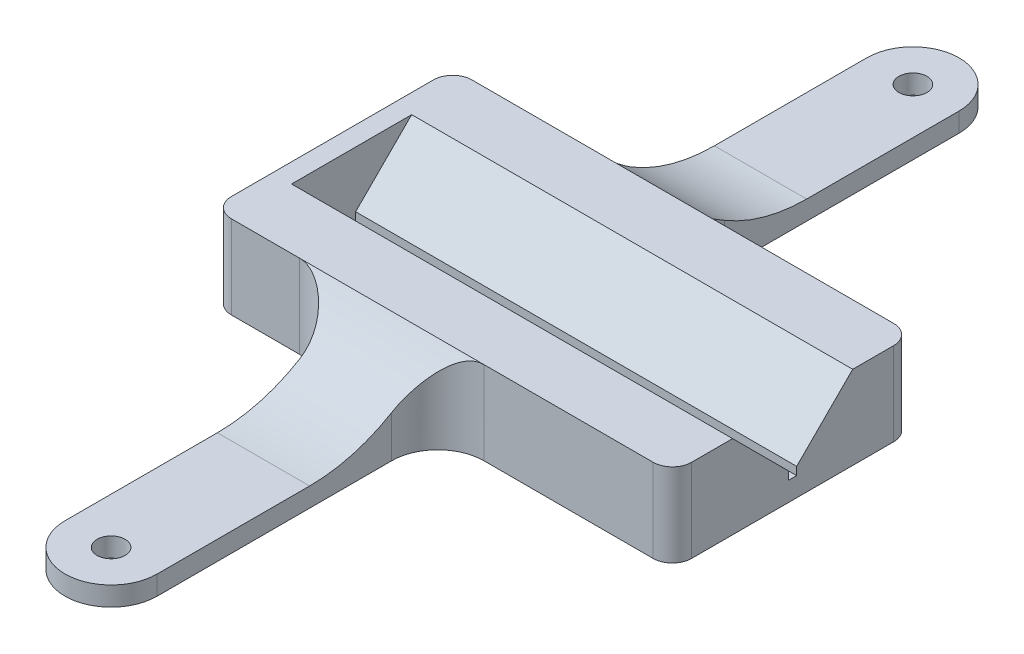
from build123d import *

# Parameters (mm, degrees)
SKETCH1_R           = 1.75
BOSS_EXTRUDE1_DEPTH = 2.4
BOSS_EXTRUDE2_DEPTH = 57.4
SKETCH3_W           = 30
SKETCH3_H           = 10.390128061
BOSS_EXTRUDE3_DEPTH = 2.4
FILLET1_START       = -61.5000001
FILLET1_DEPTH       = 23.0000001
FILLET1_START_2     = 2.4
FILLET1_2_DEPTH     = 7.99015084
FILLET2_R           = 2.4


with BuildPart() as part:
    # Sketch1 → Boss-Extrude1 (new body)
    with BuildSketch(Plane(origin=(0, 0, 0), x_dir=(1, 0, 0), z_dir=(0, 1, 0))):
        with BuildLine():
            Line((-44.25, 50), (-44.25, 20.75))
            ThreePointArc((-44.25, 20.75), (-42.565863992, 16.684136008), (-38.5, 15))
            Line((-38.5, 15), (-15, 15))
            Line((-15, 15), (-15, -15))
            Line((-15, -15), (-38.5, -15))
            ThreePointArc((-38.5, -15), (-42.565863992, -16.684136008), (-44.25, -20.75))
            Line((-44.25, -20.75), (-44.25, -50))
            ThreePointArc((-44.25, -50), (-50, -55.75), (-55.75, -50))
            Line((-55.75, -50), (-55.75, -20.75))
            ThreePointArc((-55.75, -20.75), (-57.434136008, -16.684136008), (-61.5, -15))
            Line((-61.5, -15), (-72.4, -15))
            Line((-72.4, -15), (-72.4, 15))
            Line((-72.4, 15), (-61.5, 15))
            ThreePointArc((-61.5, 15), (-57.434136008, 16.684136008), (-55.75, 20.75))
            Line((-55.75, 20.75), (-55.75, 50))
            ThreePointArc((-55.75, 50), (-50, 55.75), (-44.25, 50))
        make_face()
        with Locations(Location((-50, 50, 0), (0, 0, 270))):
            Circle(SKETCH1_R, mode=Mode.SUBTRACT)
        with Locations(Location((-50, -50, 0), (0, 0, 270))):
            Circle(SKETCH1_R, mode=Mode.SUBTRACT)
    extrude(amount=BOSS_EXTRUDE1_DEPTH)

    # Sketch2 → Boss-Extrude2 (add)
    with BuildSketch(Plane(origin=(-15, 0, 0), x_dir=(0, 0, -1), z_dir=(1, 0, 0))):
        Polygon((-15, 0), (-15, 10.390128061), (-7.490128061, 10.390128061), (-0.5, 3.4), (-0.5, 2.4), (0.5, 2.4), (0.5, 3.4), (7.490128061, 10.390128061), (15, 10.390128061), (15, 0), align=None)
    extrude(amount=-BOSS_EXTRUDE2_DEPTH)

    # Sketch3 → Boss-Extrude3 (add)
    with BuildSketch(Plane.ZY.offset(72.4)):
        with Locations((0, 5.195064031)):
            Rectangle(SKETCH3_W, SKETCH3_H)
    extrude(amount=-BOSS_EXTRUDE3_DEPTH)

    # Fillet1: read off the stored shape, not the designer's step
    # Fillet1 outline → Fillet1 (add)
    with BuildSketch(Plane.YZ.offset(FILLET1_START)):
        with BuildLine():
            Line((2.4, -15), (2.4, -30.992591285))
            ThreePointArc((2.4, -30.992591285), (4.508703468, -22.053826918), (10.39015084, -14.999982893))
            Line((10.39015084, -14.999982893), (2.4, -15))
        make_face()
        with BuildLine():
            ThreePointArc((10.39015084, 14.999982893), (4.508703468, 22.053826918), (2.4, 30.992591285))
            Line((2.4, 30.992591285), (2.4, 15))
            Line((2.4, 15), (10.39015084, 14.999982893))
        make_face()
    extrude(amount=FILLET1_DEPTH)

    # Fillet1 2 outline → Fillet1 2 (cut)
    with BuildSketch(Plane(origin=(0, 0, 0), x_dir=(1, 0, 0), z_dir=(0, 1, 0)).offset(FILLET1_START_2)):
        with BuildLine():
            ThreePointArc((-38.5, -15), (-42.565863992, -16.684136008), (-44.25, -20.75))
            Line((-44.25, -20.75), (-44.25, -32))
            Line((-44.25, -32), (-38.5, -32))
            Line((-38.5, -32), (-38.5, -15))
        make_face()
        with BuildLine():
            Line((-61.5000001, -32), (-55.75, -32))
            Line((-55.75, -32), (-55.75, -20.75))
            ThreePointArc((-55.75, -20.75), (-57.434136008, -16.684136008), (-61.5, -15))
            Line((-61.5, -15), (-61.5000001, -32))
        make_face()
        with BuildLine():
            Line((-38.5, 15), (-38.5, 32))
            Line((-38.5, 32), (-44.25, 32))
            Line((-44.25, 32), (-44.25, 20.75))
            ThreePointArc((-44.25, 20.75), (-42.565863992, 16.684136008), (-38.5, 15))
        make_face()
        with BuildLine():
            Line((-55.75, 32), (-61.5000001, 32))
            Line((-61.5000001, 32), (-61.5, 15))
            ThreePointArc((-61.5, 15), (-57.434136008, 16.684136008), (-55.75, 20.75))
            Line((-55.75, 20.75), (-55.75, 32))
        make_face()
    extrude(amount=FILLET1_2_DEPTH, mode=Mode.SUBTRACT)

    # Fillet2
    fillet2_edges = [part.edges().sort_by_distance(p)[0] for p in [
        (-72.4, 5.19506403, 15),
        (-72.4, 5.19506403, -15),
        (-15, 5.19506403, -15),
        (-15, 5.19506403, 15),
    ]]
    fillet(fillet2_edges, radius=FILLET2_R)


solid = part.part
